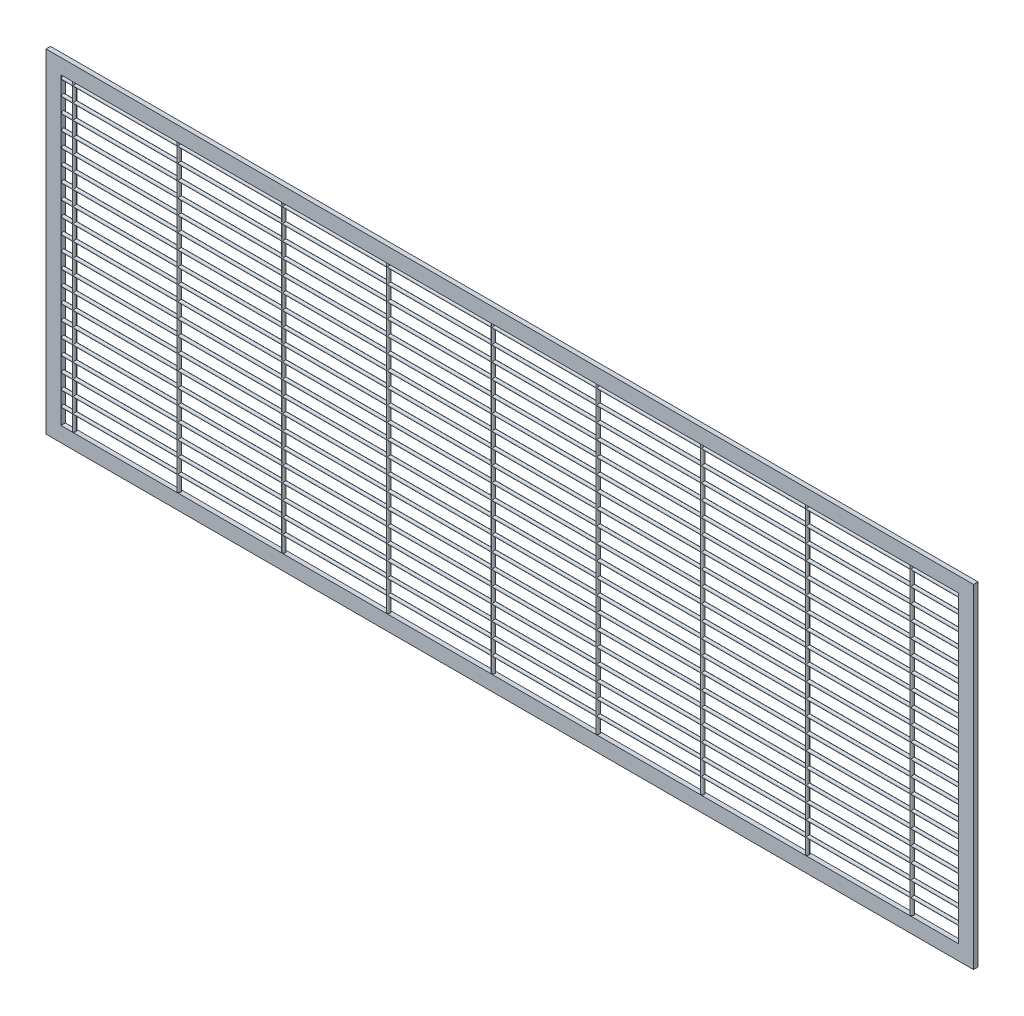
from build123d import *

# Parameters (mm, degrees)
SKETCH1_W           = 620
SKETCH1_H           = 223
SKETCH1_W_2         = 600
SKETCH1_H_2         = 203
BOSS_EXTRUDE1_DEPTH = 3
SKETCH2_R           = 1.022019174
BOSS_EXTRUDE2_DEPTH = 600
SKETCH3_R           = 1.064823912
BOSS_EXTRUDE3_DEPTH = 203


with BuildPart() as part:
    # Sketch1 → Boss-Extrude1 (new body)
    with BuildSketch(Plane.XY):
        with Locations((310, 111.5)):
            Rectangle(SKETCH1_W, SKETCH1_H)
        with Locations((310, 111.5)):
            Rectangle(SKETCH1_W_2, SKETCH1_H_2, mode=Mode.SUBTRACT)
    extrude(amount=BOSS_EXTRUDE1_DEPTH)

    # Sketch2 → Boss-Extrude2 (add)
    with BuildSketch(Plane.ZY.offset(-610)):
        with Locations((1.5, 210.459343085)):
            Circle(SKETCH2_R)
        with Locations((1.5, 200.459343085)):
            Circle(SKETCH2_R)
        with Locations((1.5, 190.459343085)):
            Circle(SKETCH2_R)
        with Locations((1.5, 180.459343085)):
            Circle(SKETCH2_R)
        with Locations((1.5, 170.459343085)):
            Circle(SKETCH2_R)
        with Locations((1.5, 160.459343085)):
            Circle(SKETCH2_R)
        with Locations((1.5, 150.459343085)):
            Circle(SKETCH2_R)
        with Locations((1.5, 140.459343085)):
            Circle(SKETCH2_R)
        with Locations((1.5, 130.459343085)):
            Circle(SKETCH2_R)
        with Locations((1.5, 120.459343085)):
            Circle(SKETCH2_R)
        with Locations((1.5, 110.459343085)):
            Circle(SKETCH2_R)
        with Locations((1.5, 100.459343085)):
            Circle(SKETCH2_R)
        with Locations((1.5, 90.459343085)):
            Circle(SKETCH2_R)
        with Locations((1.5, 80.459343085)):
            Circle(SKETCH2_R)
        with Locations((1.5, 70.459343085)):
            Circle(SKETCH2_R)
        with Locations((1.5, 60.459343085)):
            Circle(SKETCH2_R)
        with Locations((1.5, 50.459343085)):
            Circle(SKETCH2_R)
        with Locations((1.5, 40.459343085)):
            Circle(SKETCH2_R)
        with Locations((1.5, 30.459343085)):
            Circle(SKETCH2_R)
        with Locations((1.5, 20.459343085)):
            Circle(SKETCH2_R)
    extrude(amount=BOSS_EXTRUDE2_DEPTH)

    # Sketch3 → Boss-Extrude3 (add)
    with BuildSketch(Plane(origin=(0, 10, 0), x_dir=(1, 0, 0), z_dir=(0, 1, 0))):
        with Locations((17.579386394, -1.5)):
            Circle(SKETCH3_R)
        with Locations((87.579386394, -1.5)):
            Circle(SKETCH3_R)
        with Locations((157.579386394, -1.5)):
            Circle(SKETCH3_R)
        with Locations((227.579386394, -1.5)):
            Circle(SKETCH3_R)
        with Locations((297.579386394, -1.5)):
            Circle(SKETCH3_R)
        with Locations((367.579386394, -1.5)):
            Circle(SKETCH3_R)
        with Locations((437.579386394, -1.5)):
            Circle(SKETCH3_R)
        with Locations((507.579386394, -1.5)):
            Circle(SKETCH3_R)
        with Locations((577.579386394, -1.5)):
            Circle(SKETCH3_R)
    extrude(amount=BOSS_EXTRUDE3_DEPTH)


solid = part.part
